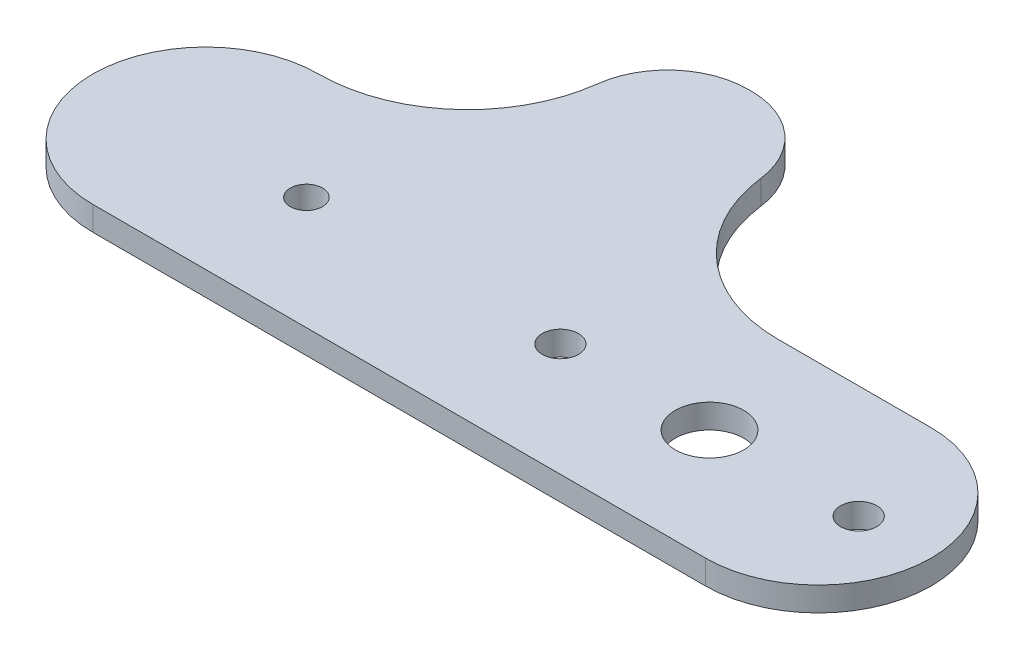
from build123d import *

# Parameters (mm, degrees)
SKETCH_1_W          = 90
SKETCH_1_H          = 28
SKETCH_1_R          = 4.25
SKETCH_1_R_2        = 2
EXTRUDE_1_DEPTH     = 3
CUT_EXTRUDE_1_REACH = 49.223
SKETCH_3_R          = 2.25
SKETCH_4_W          = 20
SKETCH_4_H          = 25
EXTRUDE_3_DEPTH     = 3
FILLET_6_R          = 18.5
FILLET_9_R          = 10
EXTRUDE_4_DEPTH     = 3
FILLET_11_RADIUS    = 14
FILLET_11_LENGTH    = 3


with BuildPart() as part:
    # 草图1 → 凸台-拉伸1 (new body)
    with BuildSketch(Plane(origin=(0, 0, 0), x_dir=(1, 0, 0), z_dir=(0, 1, 0))):
        Rectangle(SKETCH_1_W, SKETCH_1_H)
        with Locations(Location((17.5, 0, 0), (0, 0, 270))):
            Circle(SKETCH_1_R, mode=Mode.SUBTRACT)
        with Locations(Location((-32.5, 0, 0), (0, 0, 270))):
            Circle(SKETCH_1_R_2, mode=Mode.SUBTRACT)
    extrude(amount=EXTRUDE_1_DEPTH)

    # 草图3 → 切除-拉伸1 (cut, up to next)
    with BuildSketch(Plane(origin=(0, 3, 0), x_dir=(1, 0, 0), z_dir=(0, 1, 0)), mode=Mode.PRIVATE) as cut_extrude_1_sk1:
        with Locations(Location((36, 0, 0), (0, 0, 270))):
            Circle(SKETCH_3_R)
    cut_extrude_1_tool1 = extrude(cut_extrude_1_sk1.sketch, amount=-CUT_EXTRUDE_1_REACH, mode=Mode.PRIVATE) & part.part
    # 草图3 → 切除-拉伸1 (cut, up to next)
    with BuildSketch(Plane(origin=(0, 3, 0), x_dir=(1, 0, 0), z_dir=(0, 1, 0)), mode=Mode.PRIVATE) as cut_extrude_1_sk2:
        with Locations(Location((-1, 0, 0), (0, 0, 270))):
            Circle(SKETCH_3_R)
    cut_extrude_1_tool2 = extrude(cut_extrude_1_sk2.sketch, amount=-CUT_EXTRUDE_1_REACH, mode=Mode.PRIVATE) & part.part
    add(cut_extrude_1_tool1.solids().sort_by_distance((36, 3, 0))[0], mode=Mode.SUBTRACT)
    add(cut_extrude_1_tool2.solids().sort_by_distance((-1, 3, 0))[0], mode=Mode.SUBTRACT)

    # 草图4 → 凸台-拉伸3 (add)
    with BuildSketch(Plane(origin=(0, 3, 0), x_dir=(1, 0, 0), z_dir=(0, 1, 0))):
        with Locations((-16.5, 26.5)):
            Rectangle(SKETCH_4_W, SKETCH_4_H)
    extrude(amount=-EXTRUDE_3_DEPTH)

    # 圆角6
    fillet_6_edges = [part.edges().sort_by_distance(p)[0] for p in [
        (-26.5, 1.5, -14),
        (-6.5, 1.5, -14),
    ]]
    fillet(fillet_6_edges, radius=FILLET_6_R - 0.0001)  # a hair under: the kernel refuses the full size

    # 圆角9
    fillet_9_edges = [part.edges().sort_by_distance(p)[0] for p in [
        (-6.5, 1.5, -39),
        (-26.5, 1.5, -39),
    ]]
    fillet(fillet_9_edges, radius=FILLET_9_R)

    # 草图6 → 凸台-拉伸4 (add)
    with BuildSketch(Plane(origin=(0, 3, 0), x_dir=(1, 0, 0), z_dir=(0, 1, 0))):
        with BuildLine():
            Line((-45, -14), (-45, 14))
            ThreePointArc((-45, 14), (-59, 0), (-45, -14))
        make_face()
    extrude(amount=-EXTRUDE_4_DEPTH)

    # 圆角11: full round fillet: the end face becomes a half cylinder, R = half its width
    fillet_11_face = Plane((45, 1.5, 0), x_dir=(0, -1, 0), z_dir=(1, 0, 0))  # on the end face: x along it, z out of the body
    fillet_11_slab = fillet_11_face.offset(-FILLET_11_RADIUS / 2) * Box(FILLET_11_LENGTH, 2 * FILLET_11_RADIUS, FILLET_11_RADIUS, mode=Mode.PRIVATE)  # the body's end, R deep
    fillet_11_round = Plane((31, 1.5, 0), x_dir=(1, 0, 0), z_dir=(0, -1, 0)) * Cylinder(FILLET_11_RADIUS, FILLET_11_LENGTH, mode=Mode.PRIVATE)  # its axis R under the face
    add(fillet_11_slab - fillet_11_round, mode=Mode.SUBTRACT)


solid = part.part
